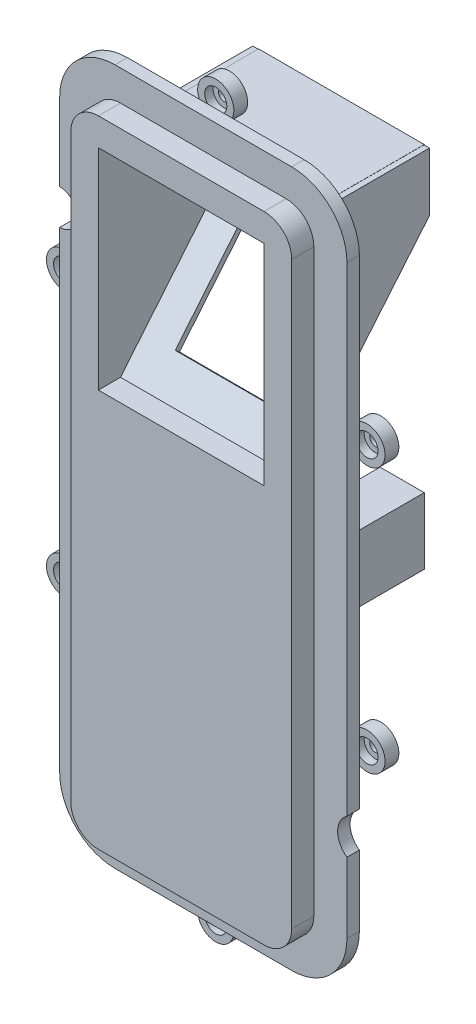
from build123d import *

# Parameters (mm, degrees)
BOSS_EXTRUDE1_DEPTH = 2.25
BOSS_EXTRUDE2_DEPTH = 4
CUT_EXTRUDE1_START  = -4
CUT_EXTRUDE1_DEPTH  = 4
SKETCH4_W           = 30
SKETCH4_H           = 38
CUT_EXTRUDE2_DEPTH  = 4
EXTRUDE_THIN2_DEPTH = 30
BOSS_EXTRUDE4_DEPTH = 1
SKETCH8_W           = 18.5
SKETCH8_H           = 24.9
CUT_EXTRUDE3_DEPTH  = 1
EXTRUDE_THIN3_DEPTH = 24
SKETCH10_R          = 3.275
BOSS_EXTRUDE5_DEPTH = 2.5
SKETCH11_R          = 1
CUT_EXTRUDE5_DEPTH  = 2.5
SKETCH12_R          = 2
CUT_EXTRUDE6_DEPTH  = 1.5
CUT_EXTRUDE7_DEPTH  = 4
CUT_EXTRUDE8_DEPTH  = 10
SKETCH17_R          = 1.9
SKETCH17_R_2        = 0.9
EXTRUDE_THIN4_DEPTH = 12.25


# Read off the part's stored shape, not the designer's step: Extrude-Thin3
with BuildPart() as part:
    # Sketch1 → Boss-Extrude1 (new body)
    with BuildSketch(Plane.XY):
        with BuildLine():
            Line((-16, 63), (16, 63))
            ThreePointArc((16, 63), (23.071067812, 60.071067812), (26, 53))
            Line((26, 53), (26, -53))
            ThreePointArc((26, -53), (23.071067812, -60.071067812), (16, -63))
            Line((16, -63), (-16, -63))
            ThreePointArc((-16, -63), (-23.071067812, -60.071067812), (-26, -53))
            Line((-26, -53), (-26, 53))
            ThreePointArc((-26, 53), (-23.071067812, 60.071067812), (-16, 63))
        make_face()
    extrude(amount=BOSS_EXTRUDE1_DEPTH)

    # Sketch2 → Boss-Extrude2 (add)
    with BuildSketch(Plane.XY.offset(2.25)):
        with BuildLine():
            Line((-15, 57.5), (15, 57.5))
            ThreePointArc((15, 57.5), (18.535533906, 56.035533906), (20, 52.5))
            Line((20, 52.5), (20, -52.5))
            ThreePointArc((20, -52.5), (18.535533906, -56.035533906), (15, -57.5))
            Line((15, -57.5), (-15, -57.5))
            ThreePointArc((-15, -57.5), (-18.535533906, -56.035533906), (-20, -52.5))
            Line((-20, -52.5), (-20, 52.5))
            ThreePointArc((-20, 52.5), (-18.535533906, 56.035533906), (-15, 57.5))
        make_face()
    extrude(amount=BOSS_EXTRUDE2_DEPTH)

    # Sketch2<2> → Cut-Extrude1 (cut)
    with BuildSketch(Plane.XY.offset(2.25).offset(CUT_EXTRUDE1_START)):
        with BuildLine():
            Line((-15, 57.5), (15, 57.5))
            ThreePointArc((15, 57.5), (18.535533906, 56.035533906), (20, 52.5))
            Line((20, 52.5), (20, -52.5))
            ThreePointArc((20, -52.5), (18.535533906, -56.035533906), (15, -57.5))
            Line((15, -57.5), (-15, -57.5))
            ThreePointArc((-15, -57.5), (-18.535533906, -56.035533906), (-20, -52.5))
            Line((-20, -52.5), (-20, 52.5))
            ThreePointArc((-20, 52.5), (-18.535533906, 56.035533906), (-15, 57.5))
        make_face()
    extrude(amount=CUT_EXTRUDE1_DEPTH, mode=Mode.SUBTRACT)


with BuildPart() as cut_extrude1_piece_1:
    # of the separate pieces the step leaves, piece 1, a body of its own (cut_extrude1_pieces)
    add(part.part.solids().sort_by_distance((-15, 57.5, 6.25))[0])

    # Sketch4 → Cut-Extrude2 (cut)
    with BuildSketch(Plane(origin=(0, 0, 2.25), x_dir=(-1, 0, 0), z_dir=(0, 0, -1))):
        with Locations((0, 33.5)):
            Rectangle(SKETCH4_W, SKETCH4_H)
    extrude(amount=-CUT_EXTRUDE2_DEPTH, mode=Mode.SUBTRACT)

    # Sketch5 → Extrude-Thin2 (add)
    with BuildSketch(Plane(origin=(-15, 0, 0), x_dir=(0, 0, -1), z_dir=(1, 0, 0))):
        Polygon((-6.25, 52.5), (21.75, 52.5), (21.75, 43.5), (-2.25, 14.5), (-6.25, 10.5), (-5.542893219, 9.792893219), (-1.50961301, 13.826173428), (22.75, 43.139872481), (22.75, 53.5), (-6.25, 53.5), align=None)
    extrude(amount=EXTRUDE_THIN2_DEPTH)

    # Sketch7 → Boss-Extrude4 (add)
    with BuildSketch(Plane(origin=(15, 0, 0), x_dir=(0, 0, -1), z_dir=(1, 0, 0))):
        Polygon((-6.238382976, 53.474895441), (22.697007931, 53.474895441), (22.697007931, 42.901217194), (-2.25, 12.979297204), (-6.238382976, 12.979297204), align=None)
    boss_extrude4 = extrude(amount=BOSS_EXTRUDE4_DEPTH)

    # Mirror1: Boss-Extrude4 across plane
    add(boss_extrude4.mirror(Plane(origin=(0, 0, 0), x_dir=(0, 0, 1), z_dir=(1, 0, 0))))

    # Sketch8 → Cut-Extrude3 (cut)
    with BuildSketch(Plane(origin=(0, 6.36172657, 7.687086272), x_dir=(-1, 0, 0), z_dir=(0, -0.6375677140342259, -0.77039432112469))):
        with Locations((0, 28.714251622)):
            Rectangle(SKETCH8_W, SKETCH8_H)
    extrude(amount=-CUT_EXTRUDE3_DEPTH, mode=Mode.SUBTRACT)

    # Extrude-Thin3 outline → Extrude-Thin3 (add)
    with BuildSketch(Plane(origin=(0, 0, 2.25), x_dir=(-1, 0, 0), z_dir=(0, 0, -1))):
        Polygon((-8, -11.100560231), (-15, -11.100560231), (-15, -1.081660237), (-8, -1.081660237), (-8, -0.081660237), (-16, -0.081660237), (-16, -12.100560231), (-8, -12.100560231), align=None)
        Polygon((12, -10.100560231), (6, -10.100560231), (6, -11.100560231), (13, -11.100560231), (13, -1.081660237), (6, -1.081660237), (6, -2.081660237), (12, -2.081660237), align=None)
    extrude(amount=EXTRUDE_THIN3_DEPTH)

    # Sketch17 → Extrude-Thin4 (add)
    with BuildSketch(Plane(origin=(0, 0, 2.25), x_dir=(-1, 0, 0), z_dir=(0, 0, -1))):
        with Locations((17.976451786, -28.276917351)):
            Circle(SKETCH17_R)
        with Locations((17.976451786, -28.276917351)):
            Circle(SKETCH17_R_2, mode=Mode.SUBTRACT)
    extrude(amount=EXTRUDE_THIN4_DEPTH)


with BuildPart() as cut_extrude1_piece_2:
    # of the separate pieces the step leaves, piece 2, a body of its own (cut_extrude1_pieces)
    add(part.part.solids().sort_by_distance((-26, 53, 0))[0])

    # Sketch10 → Boss-Extrude5 (add)
    with BuildSketch(Plane(origin=(0, 0, 0), x_dir=(-1, 0, 0), z_dir=(0, 0, -1))):
        with Locations(Location((0, 64.375, 0), (0, 0, 204.824949061))):
            Circle(SKETCH10_R)
        with Locations(Location((0, -64.375, 0), (0, 0, 180))):
            Circle(SKETCH10_R)
        with Locations(Location((27.375, 24, 0), (0, 0, 114.824949061))):
            Circle(SKETCH10_R)
        with Locations(Location((27.375, -24, 0), (0, 0, 180))):
            Circle(SKETCH10_R)
        with Locations(Location((-27.375, -24, 0), (0, 0, 294.824949061))):
            Circle(SKETCH10_R)
        with Locations(Location((-27.375, 24, 0), (0, 0, 180))):
            Circle(SKETCH10_R)
    extrude(amount=BOSS_EXTRUDE5_DEPTH)

    # Sketch11 → Cut-Extrude5 (cut)
    with BuildSketch(Plane(origin=(0, 0, -2.5), x_dir=(-1, 0, 0), z_dir=(0, 0, -1))):
        with Locations((0, 64.375)):
            Circle(SKETCH11_R)
        with Locations((-27.375, 24)):
            Circle(SKETCH11_R)
        with Locations((27.375, 24)):
            Circle(SKETCH11_R)
        with Locations((27.375, -24)):
            Circle(SKETCH11_R)
        with Locations((-27.375, -24)):
            Circle(SKETCH11_R)
        with Locations((0, -64.375)):
            Circle(SKETCH11_R)
    extrude(amount=-CUT_EXTRUDE5_DEPTH, mode=Mode.SUBTRACT)

    # Sketch12 → Cut-Extrude6 (cut)
    with BuildSketch(Plane.XY):
        with Locations((0, 64.375)):
            Circle(SKETCH12_R)
        with Locations((-27.375, 24)):
            Circle(SKETCH12_R)
        with Locations((27.375, 24)):
            Circle(SKETCH12_R)
        with Locations((27.375, -24)):
            Circle(SKETCH12_R)
        with Locations((-27.375, -24)):
            Circle(SKETCH12_R)
        with Locations((0, -64.375)):
            Circle(SKETCH12_R)
    extrude(amount=-CUT_EXTRUDE6_DEPTH, mode=Mode.SUBTRACT)

    # Sketch15 → Cut-Extrude7 (cut)
    with BuildSketch(Plane(origin=(0, 0, 0), x_dir=(-1, 0, 0), z_dir=(0, 0, -1))):
        with BuildLine():
            Line((26, 38.888045201), (26, 32.517331246))
            ThreePointArc((26, 32.517331246), (22.814643022, 35.702688223), (26, 38.888045201))
        make_face()
    extrude(amount=-CUT_EXTRUDE7_DEPTH, mode=Mode.SUBTRACT)

    # Sketch16 → Cut-Extrude8 (cut)
    with BuildSketch(Plane(origin=(0, 0, 0), x_dir=(-1, 0, 0), z_dir=(0, 0, -1))):
        with BuildLine():
            Line((-26, -40.236184249), (-26, -33.902444759))
            Line((-26, -33.902444759), (-26, -33.81046099))
            ThreePointArc((-26, -33.81046099), (-24.316694811, -37.023322619), (-26, -40.236184249))
        make_face()
    extrude(amount=-CUT_EXTRUDE8_DEPTH, mode=Mode.SUBTRACT)


solid = Compound([cut_extrude1_piece_1.part, cut_extrude1_piece_2.part])
